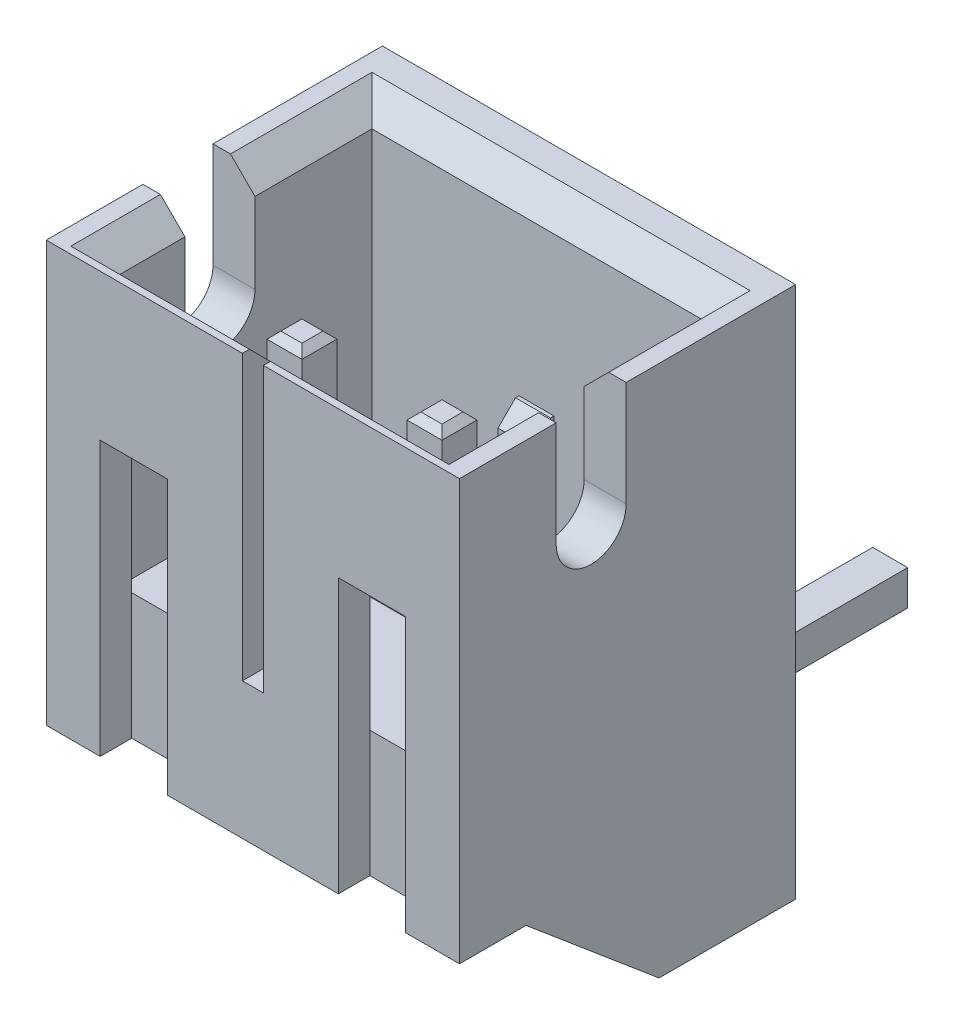
from build123d import *

# Parameters (mm, degrees)
BODY1_W                            = 5.9
BODY1_H                            = 4.8
EXTRUDE_1_DEPTH                    = 6
SKETCH_2_W                         = 4.7
SKETCH_2_H                         = 3.6
CUT_EXTRUDE_1_DEPTH                = 4.2
CHAMFER_1_SIZE                     = 0.35
SKETCH_4_W                         = 0.96
SKETCH_4_H                         = 3.91
CUT_EXTRUDE_3_DEPTH                = 0.45
SKETCH_5_W                         = 0.7
SKETCH_5_H                         = 3.45
CUT_EXTRUDE_4_DEPTH                = 0.4
CUT_EXTRUDE_6_REACH                = 11.688
SKETCH_8_W                         = 0.3
SKETCH_8_H                         = 4.05
CUT_EXTRUDE_7_REACH                = 11.688
SKETCH_15_W                        = 4.7
SKETCH_15_H                        = 1.95
CUT_EXTRUDE_9_DEPTH                = 0.65
CHAMFER_7_SIZE                     = 0.65
SKETCH_10_W                        = 0.5
SKETCH_10_H                        = 2.25
EXTRUDE_2_DEPTH                    = 0.3
CHAMFER_2_SIZE                     = 0.25
EXTRUDE_5_DEPTH                    = 0.95
SWEEP_START                        = 1.7
SWEEP_1_DEPTH                      = 0.5
CHAMFER_8_SIZE                     = 0.1
PATTERN_LINEAR_5_COUNT             = 2
PATTERN_LINEAR_5_PITCH             = 2
CHAMFER_8_OF_PATTERN_LINEAR_5_SIZE = 0.1
SKETCH_18_R                        = 0.05
CUT_EXTRUDE_10_DEPTH               = 3.4


# Read off the part's stored shape, not the designer's step: По траектории1
with BuildPart() as part:
    # Body1 → Бобышка-Вытянуть1 (new body)
    with BuildSketch(Plane(origin=(0, 0, 0), x_dir=(1, 0, 0), z_dir=(0, 1, 0))):
        with Locations((2.95, -2.4)):
            Rectangle(BODY1_W, BODY1_H)
    extrude(amount=EXTRUDE_1_DEPTH)

    # Эскиз2 → Вырез-Вытянуть1 (cut)
    with BuildSketch(Plane(origin=(0, 6, 0), x_dir=(1, 0, 0), z_dir=(0, 1, 0))):
        with Locations((2.95, -2.55)):
            Rectangle(SKETCH_2_W, SKETCH_2_H)
    extrude(amount=-CUT_EXTRUDE_1_DEPTH, mode=Mode.SUBTRACT)

    # Фаска1
    chamfer_1_edges = [part.edges().sort_by_distance(p)[0] for p in [
        (5.3, 6, 2.55),
        (2.95, 6, 0.75),
        (0.6, 6, 2.55),
        (2.95, 6, 4.35),
    ]]
    chamfer(chamfer_1_edges, length=CHAMFER_1_SIZE)

    # Эскиз4 → Вырез-Вытянуть3 (cut)
    with BuildSketch(Plane.XY.offset(4.8)):
        with Locations((1.25, 1.955)):
            Rectangle(SKETCH_4_W, SKETCH_4_H)
        with Locations((4.65, 1.955)):
            Rectangle(SKETCH_4_W, SKETCH_4_H)
    extrude(amount=-CUT_EXTRUDE_3_DEPTH, mode=Mode.SUBTRACT)

    # Эскиз5 → Вырез-Вытянуть4 (cut)
    with BuildSketch(Plane(origin=(0, 0, 4.8), x_dir=(1, 0, 0), z_dir=(0, 1, 0))):
        with Locations((1.95, 3.075)):
            Rectangle(SKETCH_5_W, SKETCH_5_H)
    cut_extrude_4 = extrude(amount=CUT_EXTRUDE_4_DEPTH, mode=Mode.SUBTRACT)

    # Эскиз8 → Вырез-Вытянуть6 (cut, up to next)
    with BuildSketch(Plane.XY.offset(4.8), mode=Mode.PRIVATE) as cut_extrude_6_sk1:
        with Locations((2.95, 3.975)):
            Rectangle(SKETCH_8_W, SKETCH_8_H)
    cut_extrude_6_tool1 = extrude(cut_extrude_6_sk1.sketch, amount=-CUT_EXTRUDE_6_REACH, mode=Mode.PRIVATE) & part.part
    add(cut_extrude_6_tool1.solids().sort_by_distance((2.95, 3.975, 4.8))[0], mode=Mode.SUBTRACT)

    # Эскиз9 → Вырез-Вытянуть7 (cut, up to next)
    with BuildSketch(Plane.ZY, mode=Mode.PRIVATE) as cut_extrude_7_sk1:
        with BuildLine():
            Line((2.42, 6), (3.42, 6))
            Line((3.42, 6), (3.42, 4.5))
            ThreePointArc((3.42, 4.5), (2.92, 4), (2.42, 4.5))
            Line((2.42, 4.5), (2.42, 6))
        make_face()
    cut_extrude_7_tool1 = extrude(cut_extrude_7_sk1.sketch, amount=-CUT_EXTRUDE_7_REACH, mode=Mode.PRIVATE) & part.part
    cut_extrude_7 = cut_extrude_7_tool1.solids().sort_by_distance((0, 5.05036, 2.92))[0]
    add(cut_extrude_7, mode=Mode.SUBTRACT)

    # Зеркальное отражение1: Вырез-Вытянуть7 across plane
    add(cut_extrude_7.mirror(Plane(origin=(2.95, 0, 0), x_dir=(0, 0, 1), z_dir=(1, 0, 0))), mode=Mode.SUBTRACT)

    # Эскиз15 → Вырез-Вытянуть9 (cut)
    with BuildSketch(Plane(origin=(0, 1.8, 0), x_dir=(1, 0, 0), z_dir=(0, 1, 0))):
        with Locations((2.95, -1.725)):
            Rectangle(SKETCH_15_W, SKETCH_15_H)
    extrude(amount=-CUT_EXTRUDE_9_DEPTH, mode=Mode.SUBTRACT)

    # Фаска7
    chamfer_7_edges = [part.edges().sort_by_distance(p)[0] for p in [
        (2.95, 1.15, 2.7),
    ]]
    chamfer(chamfer_7_edges, length=CHAMFER_7_SIZE - 0.0001)  # a hair under: the kernel refuses the full size

    # Эскиз10 → Бобышка-Вытянуть2 (add)
    with BuildSketch(Plane.XY.offset(0.75)):
        with Locations((2.95, 2.275)):
            Rectangle(SKETCH_10_W, SKETCH_10_H)
    extrude(amount=EXTRUDE_2_DEPTH)

    # Фаска2
    chamfer_2_edges = [part.edges().sort_by_distance(p)[0] for p in [
        (2.95, 3.4, 1.05),
    ]]
    chamfer(chamfer_2_edges, length=CHAMFER_2_SIZE)

    # Эскиз17 → Бобышка-Вытянуть5 (add)
    with BuildSketch(Plane.ZY):
        Polygon((0, -1.6), (1.95, -1.6), (3.85, 0), (0, 0), align=None)
    extrude_5 = extrude(amount=-EXTRUDE_5_DEPTH)

    # Зеркальное отражение3: Бобышка-Вытянуть5 across plane
    add(extrude_5.mirror(Plane(origin=(2.95, 0, 0), x_dir=(0, 0, 1), z_dir=(1, 0, 0))))

    # По траектории1 outline → По траектории1 (add)
    with BuildSketch(Plane.YZ.offset(SWEEP_START)):
        with BuildLine():
            add(Edge.make_bspline(
                [(-0.5, 2.45), (-0.5, 2.683362296), (-0.405057001, 2.917735205), (-0.152065654, 3.170726552), (-0.050887811, 3.237723146), (0.166472235, 3.327081743), (0.298557942, 3.349954697), (0.4, 3.35)],
                knots=[0.50998091, 0.50998091, 0.50998091, 0.50998091, 0.55448514, 0.55448514, 0.576737255, 0.576737255, 0.59898937, 0.59898937, 0.59898937, 0.59898937], degree=3))
            Line((-0.5, 2.45), (-0.5, -3.4))
            Line((-0.5, -3.4), (0, -3.4))
            Line((0, -3.4), (0, 2.45))
            add(Edge.make_bspline(
                [(0, 2.45), (0, 2.553716576), (0.042196888, 2.657882313), (0.154637487, 2.770322912), (0.199605417, 2.800099176), (0.296209882, 2.839814108), (0.331279974, 2.849979865), (0.4, 2.85)],
                knots=[0.50998091, 0.50998091, 0.50998091, 0.50998091, 0.55448514, 0.55448514, 0.576737255, 0.576737255, 0.59898937, 0.59898937, 0.59898937, 0.59898937], degree=3))
            Line((0.4, 2.85), (0.4, 3.35))
        make_face()
        with BuildLine():
            Line((1.8, 3.35), (1.8, 2.85))
            add(Edge.make_bspline(
                [(1.8, 2.85), (2.1, 2.85), (2.4, 2.85), (3.466666667, 2.85), (4.233333333, 2.85), (5, 2.85)],
                knots=[0.721036083, 0.721036083, 0.721036083, 0.721036083, 0.799494685, 0.799494685, 1, 1, 1, 1], degree=3))
            Line((5, 2.85), (5, 3.35))
            add(Edge.make_bspline(
                [(1.8, 3.35), (2.1, 3.35), (2.4, 3.35), (3.466666667, 3.35), (4.233333333, 3.35), (5, 3.35)],
                knots=[0.721036083, 0.721036083, 0.721036083, 0.721036083, 0.799494685, 0.799494685, 1, 1, 1, 1], degree=3))
        make_face()
    sweep_1 = extrude(amount=SWEEP_1_DEPTH)

    # Фаска8
    chamfer_8_edges = [part.edges().sort_by_distance(p)[0] for p in [
        (1.95, 5, 2.85),
        (2.2, 5, 3.1),
        (1.95, 5, 3.35),
        (1.7, 5, 3.1),
        (1.95, -0.5, -3.4),
        (2.2, -0.25, -3.4),
        (1.95, 0, -3.4),
        (1.7, -0.25, -3.4),
    ]]
    chamfer(chamfer_8_edges, length=CHAMFER_8_SIZE)

    # Линейный массив5: Вырез-Вытянуть4, По траектории1 ×2
    with Locations(*[(i * PATTERN_LINEAR_5_PITCH, 0, 0) for i in range(1, PATTERN_LINEAR_5_COUNT)]):
        add(cut_extrude_4, mode=Mode.SUBTRACT)
        add(sweep_1)

    # Фаска8 of Линейный массив5
    chamfer_8_of_pattern_linear_5_edges = [part.edges().sort_by_distance(p)[0] for p in [
        (3.95, 5, 2.85),
        (4.2, 5, 3.1),
        (3.95, 5, 3.35),
        (3.7, 5, 3.1),
        (3.95, -0.5, -3.4),
        (4.2, -0.25, -3.4),
        (3.95, 0, -3.4),
        (3.7, -0.25, -3.4),
    ]]
    chamfer(chamfer_8_of_pattern_linear_5_edges, length=CHAMFER_8_OF_PATTERN_LINEAR_5_SIZE)

    # Эскиз18 → Вырез-Вытянуть10 (cut)
    with BuildSketch(Plane(origin=(0, 0, 0), x_dir=(-1, 0, 0), z_dir=(0, 0, -1))):
        with Locations(Location((-1.95, -0.25, 0), (0, 0, 90))):
            Circle(SKETCH_18_R)
    extrude(amount=CUT_EXTRUDE_10_DEPTH, mode=Mode.SUBTRACT)


solid = part.part
